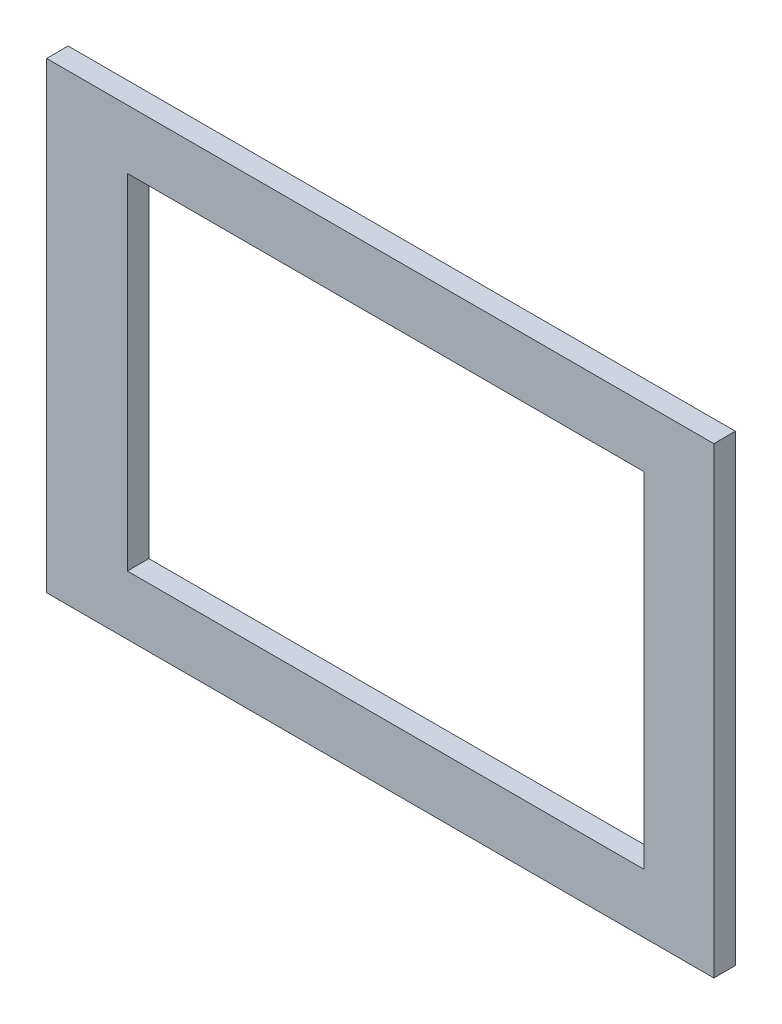
from build123d import *

# Parameters (mm, degrees)
SKETCH1_W           = 196.85
SKETCH1_H           = 136.525
BOSS_EXTRUDE1_DEPTH = 6.35
SKETCH2_W           = 152.4
SKETCH2_H           = 101.6
CUT_EXTRUDE1_DEPTH  = 196.541125609


with BuildPart() as part:
    # Sketch1 → Boss-Extrude1 (new body)
    with BuildSketch(Plane.XY):
        with Locations((-33.205526088, -76.2)):
            Rectangle(SKETCH1_W, SKETCH1_H)
    extrude(amount=BOSS_EXTRUDE1_DEPTH)

    # Sketch2 → Cut-Extrude1 (cut, through all)
    with BuildSketch(Plane.XY.offset(6.35)):
        with Locations((-31.618026088, -76.2)):
            Rectangle(SKETCH2_W, SKETCH2_H)
    extrude(amount=-CUT_EXTRUDE1_DEPTH, mode=Mode.SUBTRACT)


solid = part.part
